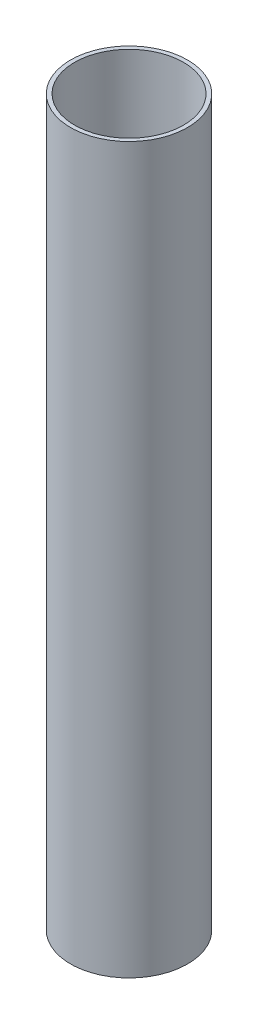
from build123d import *

# Parameters (mm, degrees)
SKETCH1_W = 1.4224
SKETCH1_H = 254


with BuildPart() as part:
    # Sketch1 → Revolve2 (revolve)
    with BuildSketch(Plane.XY):
        with Locations((-19.812, 127)):
            Rectangle(SKETCH1_W, SKETCH1_H)
    revolve(axis=Axis((0, 0, 0), (0, 1, 0)))


solid = part.part
